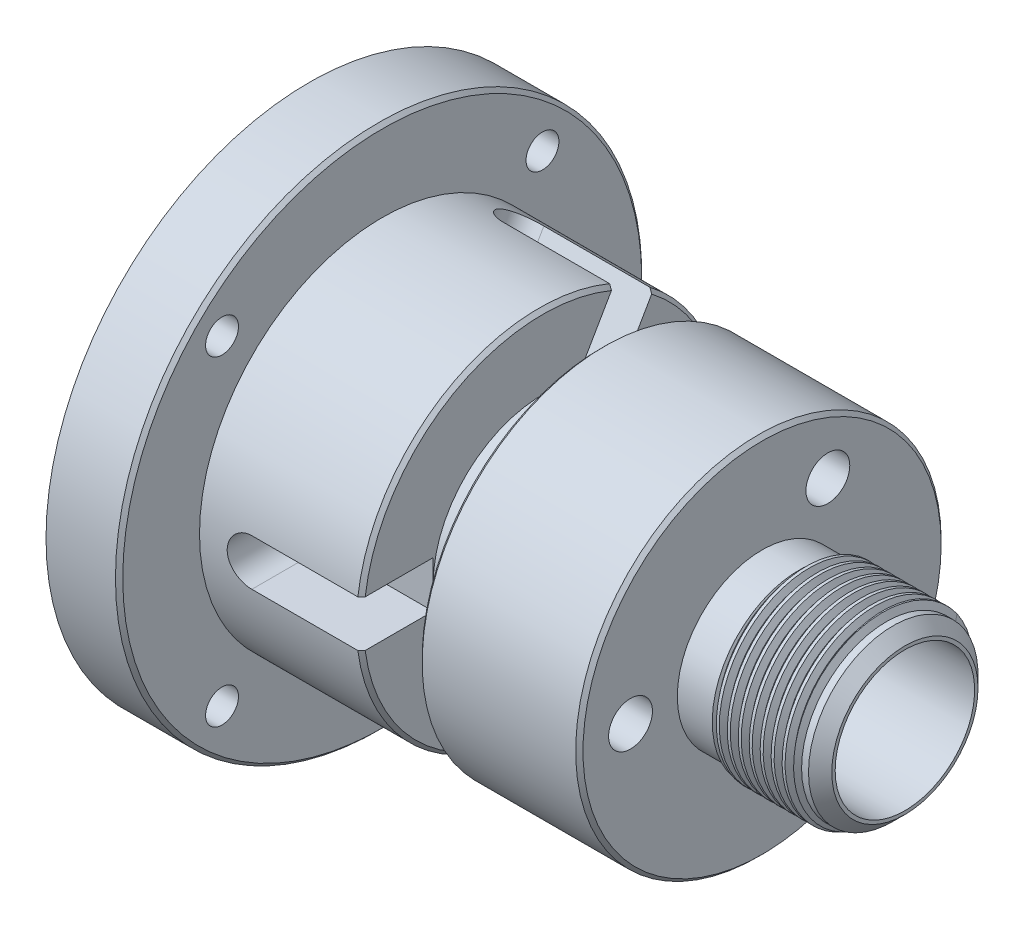
from build123d import *

# Parameters (mm, degrees)
M4_CLEARANCE_HOLE1_D      = 4.5
CHAMFER1_SIZE             = 2.5
CUT_SWEEP1_PITCH          = 1.5
SKETCH9_R                 = 25
SKETCH9_R_2               = 12.5
BOSS_EXTRUDE3_DEPTH       = 51.96
SKETCH12_R                = 3
CUT_EXTRUDE2_DEPTH        = 22
SKETCH13_W                = 8
SKETCH13_H                = 10
SKETCH14_R                = 9.5
CUT_EXTRUDE3_DEPTH        = 97.095005073
M6X1_0_TAPPED_HOLE1_D     = 5
M6X1_0_TAPPED_HOLE1_DEPTH = 13
M6X1_0_TAPPED_HOLE1_TIP   = 1.502151548
CHAMFER2_SIZE             = 0.5
CUT_EXTRUDE4_START        = -15
CUT_EXTRUDE4_DEPTH        = 82.095005158
CIRPATTERN1_COUNT         = 3


with BuildPart() as part:
    # Sketch1 → Revolve1 (revolve)
    with BuildSketch(Plane.XY, mode=Mode.PRIVATE) as revolve1_sk:
        Polygon((6, 12.5), (10, 12.5), (10, 36), (0, 36), (0, 22.5), (6, 22.5), align=None)
        Polygon((81.5, 9.54), (81.5, 12.5), (10, 12.5), (6, 12.5), (6, 9.54), align=None)
    revolve(revolve1_sk.sketch.rotate(Axis((0, 0, 0), (1, 0, 0)), 90), axis=Axis((0, 0, 0), (1, 0, 0)))

    # M4 Clearance Hole1 (through all)
    with Locations(Plane(origin=(10, 0, 0), x_dir=(0, 0, -1), z_dir=(1, 0, 0))):
        with Locations((-21.920310217, 21.920310217), (21.920310217, 21.920310217), (-21.920310217, -21.920310217), (21.920310217, -21.920310217)):
            Hole(M4_CLEARANCE_HOLE1_D / 2)

    # Chamfer1
    chamfer1_edges = [part.edges().sort_by_distance(p)[0] for p in [
        (81.5, 0, -12.5),
    ]]
    chamfer(chamfer1_edges, length=CHAMFER1_SIZE)

    # Sketch5 → Cut-Revolve1 (revolve, cut)
    with BuildSketch(Plane.XY, mode=Mode.PRIVATE) as cut_revolve1_sk:
        Polygon((81.96, 12.5), (81.96, 11.595), (78.96, 11.595), (78.463478768, 12.455), (67.456521232, 12.455), (66.96, 11.595), (61.96, 11.595), (61.96, 12.5), align=None)
    revolve(cut_revolve1_sk.sketch.rotate(Axis((0, 0, 0), (1, 0, 0)), 90), axis=Axis((0, 0, 0), (1, 0, 0)), mode=Mode.SUBTRACT)

    # Cut-Sweep1: the profile of Sketch8 screwed along a right-hand helix of 11 turns, 8 arcs to a turn; built about Z, then put on its axis
    cut_sweep1_z = Axis((0, 0, 0), (0, 0, 1))
    cut_sweep1_corners = [(12.48, 0, 0.01337677), (12.48, 0, -0.175623885), (11.672, 0, -0.642122902), (11.672, 0, -0.831123557), (12.48, 0, -1.297622575), (12.48, 0, -1.48662323), (12.669000655, 0, -1.48662323), (12.669000655, 0, 0.01337677)]
    with BuildLine(mode=Mode.PRIVATE) as cut_sweep1_profile:
        Line(cut_sweep1_corners[0], cut_sweep1_corners[1])
        Line(cut_sweep1_corners[1], cut_sweep1_corners[2])
        Line(cut_sweep1_corners[2], cut_sweep1_corners[3])
        Line(cut_sweep1_corners[3], cut_sweep1_corners[4])
        Line(cut_sweep1_corners[4], cut_sweep1_corners[5])
        Line(cut_sweep1_corners[5], cut_sweep1_corners[6])
        Line(cut_sweep1_corners[6], cut_sweep1_corners[7])
        Line(cut_sweep1_corners[7], cut_sweep1_corners[0])
    cut_sweep1_cap = Face(cut_sweep1_profile.wire())
    cut_sweep1_turn_angles = [0, 22.5, 45, 67.5, 90, 112.5, 135, 157.5, 180, 202.5, 225, 247.5, 270, 292.5, 315, 337.5, 360]
    cut_sweep1_turn_weights = [1, 0.9238795325112867, 1, 0.9238795325112867, 1, 0.9238795325112867, 1, 0.9238795325112867, 1, 0.9238795325112867, 1, 0.9238795325112867, 1, 0.9238795325112867, 1, 0.9238795325112867, 1]
    cut_sweep1_turn_rails = [Edge.make_bspline([Vector(p[0], p[1], 0).rotate(cut_sweep1_z, cut_sweep1_turn_angles[k]) / cut_sweep1_turn_weights[k] + Vector(0, 0, p[2] + CUT_SWEEP1_PITCH * cut_sweep1_turn_angles[k] / 360) for k in range(17)], [0, 0, 0, 1, 1, 2, 2, 3, 3, 4, 4, 5, 5, 6, 6, 7, 7, 8, 8, 8], 2, cut_sweep1_turn_weights) for p in cut_sweep1_corners]
    cut_sweep1_turn_sides = [Face.make_surface_from_curves(cut_sweep1_turn_rails[p[0]], cut_sweep1_turn_rails[p[1]]) for p in [(0, 1), (1, 2), (2, 3), (3, 4), (4, 5), (5, 6), (6, 7), (7, 0)]]
    cut_sweep1_turn = Solid(Shell([*cut_sweep1_turn_sides, cut_sweep1_cap, cut_sweep1_cap.rotate(cut_sweep1_z, 360).moved(Location((0, 0, CUT_SWEEP1_PITCH * 360 / 360)))]))
    cut_sweep1_each = [*[cut_sweep1_turn.moved(Location((0, 0, CUT_SWEEP1_PITCH * i))) for i in range(11)]]
    add(Plane(origin=(81.5, 0, 0), x_dir=(0, 1, 0), z_dir=(-1, 0, 0)) * Compound([cut_sweep1_each[i] for i in range(0, 11, 2)]), mode=Mode.SUBTRACT)
    add(Plane(origin=(81.5, 0, 0), x_dir=(0, 1, 0), z_dir=(-1, 0, 0)) * Compound([cut_sweep1_each[i] for i in range(1, 11, 2)]), mode=Mode.SUBTRACT)

    # Sketch9 → Boss-Extrude3 (add)
    with BuildSketch(Plane(origin=(10, 0, 0), x_dir=(0, 0, -1), z_dir=(1, 0, 0))):
        with Locations(Location((0, 0, 0), (0, 0, 180))):
            Circle(SKETCH9_R)
        Circle(SKETCH9_R_2, mode=Mode.SUBTRACT)
    extrude(amount=BOSS_EXTRUDE3_DEPTH)

    # Sketch12 → Cut-Extrude2 (cut)
    with BuildSketch(Plane(origin=(61.96, 0, 0), x_dir=(0, 0, -1), z_dir=(1, 0, 0))):
        with Locations((9, 15.588457268)):
            Circle(SKETCH12_R)
        with Locations((9, -15.588457268)):
            Circle(SKETCH12_R)
        with Locations((-18, 0)):
            Circle(SKETCH12_R)
    extrude(amount=-CUT_EXTRUDE2_DEPTH, mode=Mode.SUBTRACT)

    # Sketch13 → Cut-Revolve2 (revolve, cut)
    with BuildSketch(Plane.XY, mode=Mode.PRIVATE) as cut_revolve2_sk:
        with Locations((35.96, 20)):
            Rectangle(SKETCH13_W, SKETCH13_H)
    revolve(cut_revolve2_sk.sketch.rotate(Axis((0, 0, 0), (-1, 0, 0)), 78.184023659), axis=Axis((0, 0, 0), (-1, 0, 0)), mode=Mode.SUBTRACT)

    # Sketch14 → Cut-Extrude3 (cut, through all)
    with BuildSketch(Plane.XY):
        with Locations((20.98, 0)):
            Circle(SKETCH14_R)
    extrude(amount=-CUT_EXTRUDE3_DEPTH, mode=Mode.SUBTRACT)

    # M6x1.0 Tapped Hole1
    with Locations(Plane(origin=(0, 0, -25), x_dir=(-1, 0, 0), z_dir=(0, 0, -1))):
        with Locations((-50.96, 0)):
            Hole(M6X1_0_TAPPED_HOLE1_D / 2, depth=M6X1_0_TAPPED_HOLE1_DEPTH)
            with Locations((0, 0, -(M6X1_0_TAPPED_HOLE1_DEPTH + M6X1_0_TAPPED_HOLE1_TIP / 2))):  # 118° drill point
                Cone(0, M6X1_0_TAPPED_HOLE1_D / 2, M6X1_0_TAPPED_HOLE1_TIP, mode=Mode.SUBTRACT)

    # Chamfer2
    chamfer2_edges = [part.edges().sort_by_distance(p)[0] for p in [
        (39.96, 0, -25),
        (31.96, 0, -25),
        (10, 0, -36),
        (61.96, 0, -25),
    ]]
    chamfer(chamfer2_edges, length=CHAMFER2_SIZE)

    # Sketch18 → Cut-Extrude4 (cut, through all)
    with BuildSketch(Plane(origin=(0, 0, 0), x_dir=(-1, 0, 0), z_dir=(0, -0.8660254037844346, 0.5000000000000071)).offset(CUT_EXTRUDE4_START)):
        with BuildLine():
            Line((-31.96, 3.175), (-16.96, 3.175))
            ThreePointArc((-16.96, 3.175), (-13.785, 0), (-16.96, -3.175))
            Line((-16.96, -3.175), (-31.96, -3.175))
            ThreePointArc((-31.96, -3.175), (-35.135, 0), (-31.96, 3.175))
        make_face()
    cut_extrude4 = extrude(amount=-CUT_EXTRUDE4_DEPTH, mode=Mode.SUBTRACT)

    # CirPattern1: Cut-Extrude4 ×3 about axis
    cirpattern1_axis = Axis((0, 0, 0), (1, 0, 0))
    for i in range(1, CIRPATTERN1_COUNT):
        add(cut_extrude4.rotate(cirpattern1_axis, i * 360 / CIRPATTERN1_COUNT), mode=Mode.SUBTRACT)


solid = part.part
